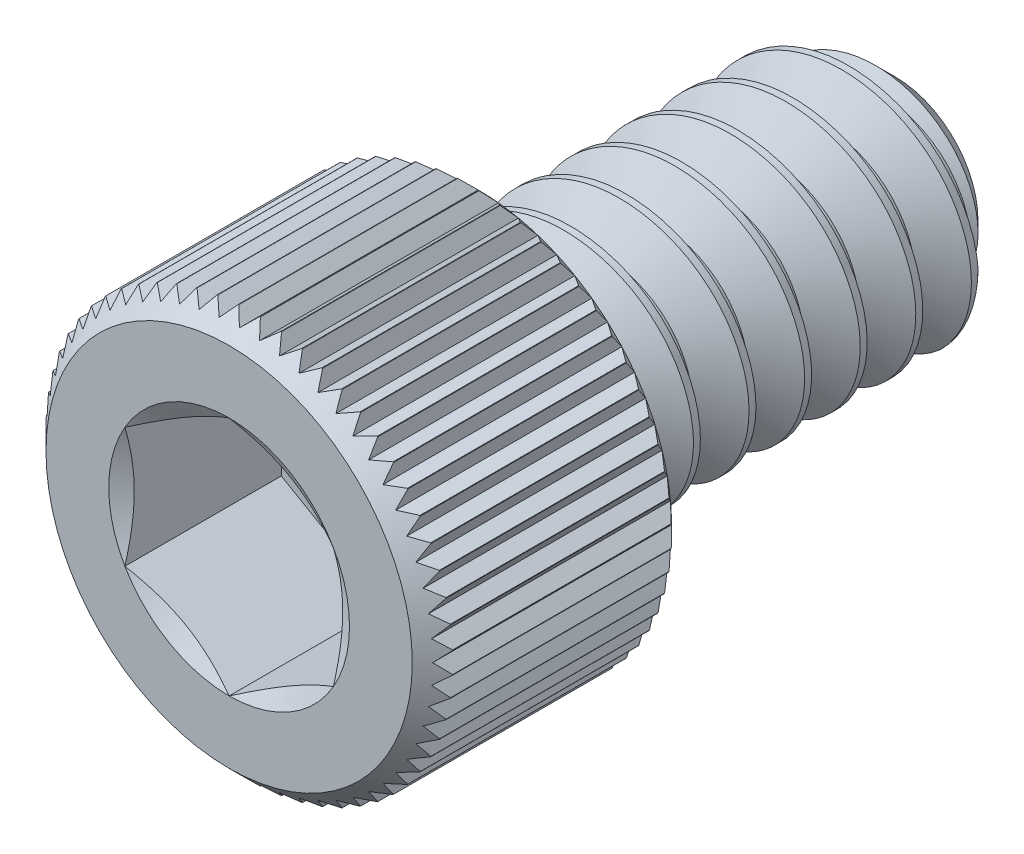
from build123d import *

# Parameters (mm, degrees)
CUT_EXTRUDE1_DEPTH        = 1.7859375
CHAMFER1_SIZE             = 0.23241
CHAMFER2_SIZE             = 0.116205
CUT_SWEEP1_PITCH          = 0.635
BOSS_EXTRUDE5_START       = -0.079375
BOSS_EXTRUDE5_OUTLINE_R   = 1.4859
BOSS_EXTRUDE5_OUTLINE_R_2 = 1.4224
BOSS_EXTRUDE5_DEPTH       = 0.079375
CUT_EXTRUDE3_REACH        = 7.787
CIRPATTERN1_COUNT         = 60


# Read off the part's stored shape, not the designer's step: Boss-Extrude5, Boss-Extrude4
with BuildPart() as part:
    # Sketch2 → Revolve1 (revolve)
    with BuildSketch(Plane(origin=(0, 0, 0), x_dir=(0, 0, -1), z_dir=(1, 0, 0)), mode=Mode.PRIVATE) as revolve1_sk:
        Polygon((3.80365, 0.94615), (3.3274, 1.4224), (-0.95885, 1.4224), (-0.95885, 2.3241), (-3.80365, 2.3241), (-3.80365, 0), (3.80365, 0), align=None)
    revolve(revolve1_sk.sketch.rotate(Axis((0, 0, -3.80365), (0, 0, 1)), 90), axis=Axis((0, 0, -3.80365), (0, 0, 1)))

    # Sketch4 → Cut-Extrude1 (cut)
    with BuildSketch(Plane.XY.offset(3.80365)):
        Polygon((0, 1.374815329), (-1.190625, 0.687407664), (-1.190625, -0.687407664), (0, -1.374815329), (1.190625, -0.687407664), (1.190625, 0.687407664), align=None)
    extrude(amount=-CUT_EXTRUDE1_DEPTH, mode=Mode.SUBTRACT)

    # Cut-Extrude2 cone 1 section (through the dimple's axis) → Cut-Extrude2 (revolve, cut)
    with BuildSketch(Plane(origin=(0, 0, 3.80365), x_dir=(0, -1, 0), z_dir=(1, 0, 0))):
        Polygon((0, 0), (1.374815329, 0), (0, 0.79375), align=None)
    revolve(axis=Axis((0, 0, 3.80365), (0, 0, -1)), mode=Mode.SUBTRACT)

    # Chamfer1
    chamfer1_edges = [part.edges().sort_by_distance(p)[0] for p in [
        (2.3241, 0, 3.80365),
    ]]
    chamfer(chamfer1_edges, length=CHAMFER1_SIZE)

    # Chamfer2
    chamfer2_edges = [part.edges().sort_by_distance(p)[0] for p in [
        (2.3241, 0, 0.95885),
    ]]
    chamfer(chamfer2_edges, length=CHAMFER2_SIZE)


with BuildPart() as body_2:
    # Split1: the piece on the far side of the plane
    add(part.part)
    split(bisect_by=Plane(origin=(0, 0, 0.879475), x_dir=(-1, 0, 0), z_dir=(0, 0, -1)), keep=Keep.BOTTOM)

    # Boss-Extrude5 outline → Boss-Extrude5 (add)
    with BuildSketch(Plane(origin=(0, 0, 0.879475), x_dir=(-1, 0, 0), z_dir=(0, 0, -1)).offset(BOSS_EXTRUDE5_START)):
        Circle(BOSS_EXTRUDE5_OUTLINE_R)
        Circle(BOSS_EXTRUDE5_OUTLINE_R_2, mode=Mode.SUBTRACT)
    extrude(amount=BOSS_EXTRUDE5_DEPTH)


with BuildPart() as part_1:
    add(part.part)

    # Split1
    split(bisect_by=Plane(origin=(0, 0, 0.879475), x_dir=(-1, 0, 0), z_dir=(0, 0, -1)), keep=Keep.TOP)

    # Cut-Sweep1: the profile of Sketch7 profile screwed along a right-hand helix of 8.5 turns, 6 arcs to a turn; built about Z, then put on its axis
    cut_sweep1_z = Axis((0, 0, 0), (0, 0, 1))
    cut_sweep1_corners = [(1.4227, 0, 0.000173205), (1.4227, 0, -0.555798205), (1.009955401, 0, -0.3175), (1.009955401, 0, -0.238125)]
    with BuildLine(mode=Mode.PRIVATE) as cut_sweep1_profile:
        Line(cut_sweep1_corners[0], cut_sweep1_corners[1])
        Line(cut_sweep1_corners[1], cut_sweep1_corners[2])
        Line(cut_sweep1_corners[2], cut_sweep1_corners[3])
        Line(cut_sweep1_corners[3], cut_sweep1_corners[0])
    cut_sweep1_cap = Face(cut_sweep1_profile.wire())
    cut_sweep1_turn_angles = [0, 30, 60, 90, 120, 150, 180, 210, 240, 270, 300, 330, 360]
    cut_sweep1_turn_weights = [1, 0.8660254037844387, 1, 0.8660254037844387, 1, 0.8660254037844387, 1, 0.8660254037844387, 1, 0.8660254037844387, 1, 0.8660254037844387, 1]
    cut_sweep1_turn_rails = [Edge.make_bspline([Vector(p[0], p[1], 0).rotate(cut_sweep1_z, cut_sweep1_turn_angles[k]) / cut_sweep1_turn_weights[k] + Vector(0, 0, p[2] + CUT_SWEEP1_PITCH * cut_sweep1_turn_angles[k] / 360) for k in range(13)], [0, 0, 0, 1, 1, 2, 2, 3, 3, 4, 4, 5, 5, 6, 6, 6], 2, cut_sweep1_turn_weights) for p in cut_sweep1_corners]
    cut_sweep1_turn_sides = [Face.make_surface_from_curves(cut_sweep1_turn_rails[p[0]], cut_sweep1_turn_rails[p[1]]) for p in [(0, 1), (1, 2), (2, 3), (3, 0)]]
    cut_sweep1_turn = Solid(Shell([*cut_sweep1_turn_sides, cut_sweep1_cap, cut_sweep1_cap.rotate(cut_sweep1_z, 360).moved(Location((0, 0, CUT_SWEEP1_PITCH * 360 / 360)))]))
    cut_sweep1_last_angles = [2880, 2910, 2940, 2970, 3000, 3030, 3060]
    cut_sweep1_last_weights = [1, 0.8660254037844387, 1, 0.8660254037844387, 1, 0.8660254037844426, 1]
    cut_sweep1_last_rails = [Edge.make_bspline([Vector(p[0], p[1], 0).rotate(cut_sweep1_z, cut_sweep1_last_angles[k]) / cut_sweep1_last_weights[k] + Vector(0, 0, p[2] + CUT_SWEEP1_PITCH * cut_sweep1_last_angles[k] / 360) for k in range(7)], [0, 0, 0, 1, 1, 2, 2, 3, 3, 3], 2, cut_sweep1_last_weights) for p in cut_sweep1_corners]
    cut_sweep1_last_sides = [Face.make_surface_from_curves(cut_sweep1_last_rails[p[0]], cut_sweep1_last_rails[p[1]]) for p in [(0, 1), (1, 2), (2, 3), (3, 0)]]
    cut_sweep1_last = Solid(Shell([*cut_sweep1_last_sides, cut_sweep1_cap.rotate(cut_sweep1_z, 2880).moved(Location((0, 0, CUT_SWEEP1_PITCH * 2880 / 360))), cut_sweep1_cap.rotate(cut_sweep1_z, 3060).moved(Location((0, 0, CUT_SWEEP1_PITCH * 3060 / 360)))]))
    cut_sweep1_each = [*[cut_sweep1_turn.moved(Location((0, 0, CUT_SWEEP1_PITCH * i))) for i in range(8)], cut_sweep1_last]
    add(Plane(origin=(0, 0, -3.80365), x_dir=(0, 1, 0), z_dir=(0, 0, 1)) * Compound([cut_sweep1_each[i] for i in range(0, 9, 2)]), mode=Mode.SUBTRACT)
    add(Plane(origin=(0, 0, -3.80365), x_dir=(0, 1, 0), z_dir=(0, 0, 1)) * Compound([cut_sweep1_each[i] for i in range(1, 9, 2)]), mode=Mode.SUBTRACT)

    add(body_2.part)  # Boss-Extrude4 merges body 2
    # Boss-Extrude4 outline → Boss-Extrude4 (revolve)
    with BuildSketch(Plane.XZ):
        Polygon((1.009950696, 0.879475), (1.009950696, 0.606426514), (1.4859, 0.879475), align=None)
    revolve(axis=Axis((0, 0, 0), (0, 0, 1)))

    # Cut-Extrude3: up to this cone (the profile starts inside it)
    cut_extrude3_end = Plane(origin=(0, 0, 0.95885), z_dir=(0, 0, -1)).offset(-4.936489) * Cone(1e-06, 18.15998, 18.159979, align=(Align.CENTER, Align.CENTER, Align.MIN), mode=Mode.PRIVATE)
    # Sketch9 → Cut-Extrude3 (cut, up to the surface)
    with BuildSketch(Plane(origin=(0, 0, 0.95885), x_dir=(-1, 0, 0), z_dir=(0, 0, -1)), mode=Mode.PRIVATE) as cut_extrude3_sk1:
        Polygon((0, 2.207895), (-0.24360184, 2.440305), (0.24360184, 2.440305), align=None)
    cut_extrude3_tool1 = extrude(cut_extrude3_sk1.sketch, amount=-CUT_EXTRUDE3_REACH, mode=Mode.PRIVATE) & cut_extrude3_end
    cut_extrude3 = cut_extrude3_tool1.solids().sort_by_distance((0, 2.362835, 0.95885))[0]
    add(cut_extrude3, mode=Mode.SUBTRACT)

    # CirPattern1: Cut-Extrude3 ×60 about axis
    cirpattern1_axis = Axis((0, 0, 0), (0, 0, 1))
    for i in range(1, CIRPATTERN1_COUNT):
        add(cut_extrude3.rotate(cirpattern1_axis, i * 360 / CIRPATTERN1_COUNT), mode=Mode.SUBTRACT)


solid = part_1.part
